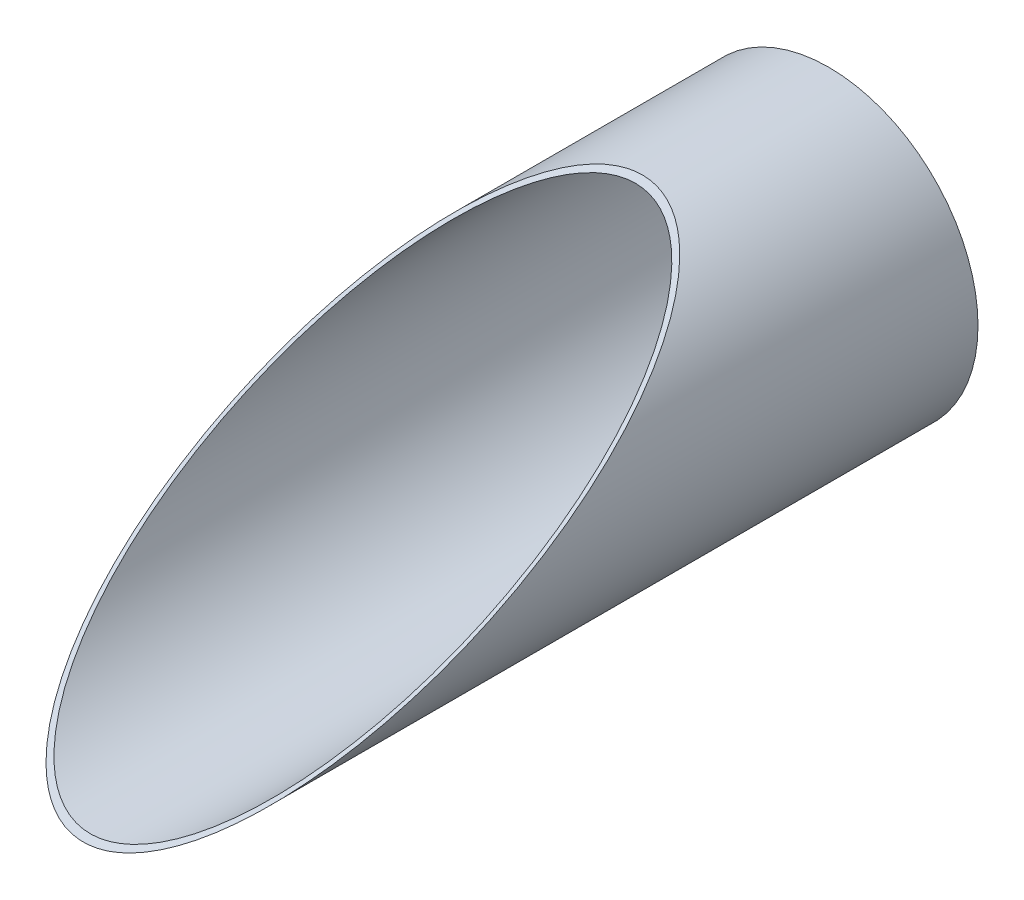
from build123d import *

# Parameters (mm, degrees)
SKETCH1_R               = 20
BOSS_EXTRUDE1_DEPTH     = 100
CUT_EXTRUDE1_DEPTH      = 104.923048454
CUT_EXTRUDE1_DEPTH_BACK = 104.923048454
SHELL1_OUTLINE_R        = 19.5
SHELL1_DEPTH            = 99.0625001


# Read off the part's stored shape, not the designer's step: Shell1
with BuildPart() as part:
    # Sketch1 → Boss-Extrude1 (new body)
    with BuildSketch(Plane.XY):
        Circle(SKETCH1_R)
    extrude(amount=BOSS_EXTRUDE1_DEPTH)

    # Sketch2 → Cut-Extrude1 (cut, two sides: drawn at the far end of the back side and taken through both)
    with BuildSketch(Plane(origin=(0, 0, 0), x_dir=(0, 0, -1), z_dir=(1, 0, 0)).offset(-CUT_EXTRUDE1_DEPTH_BACK)):
        Polygon((-100, -20), (-25, 20), (-100, 20), align=None)
    extrude(amount=CUT_EXTRUDE1_DEPTH + CUT_EXTRUDE1_DEPTH_BACK, mode=Mode.SUBTRACT)

    # Shell1 outline → Shell1 (cut)
    with BuildSketch(Plane.XY):
        Circle(SHELL1_OUTLINE_R)
    extrude(amount=SHELL1_DEPTH, mode=Mode.SUBTRACT)


solid = part.part
